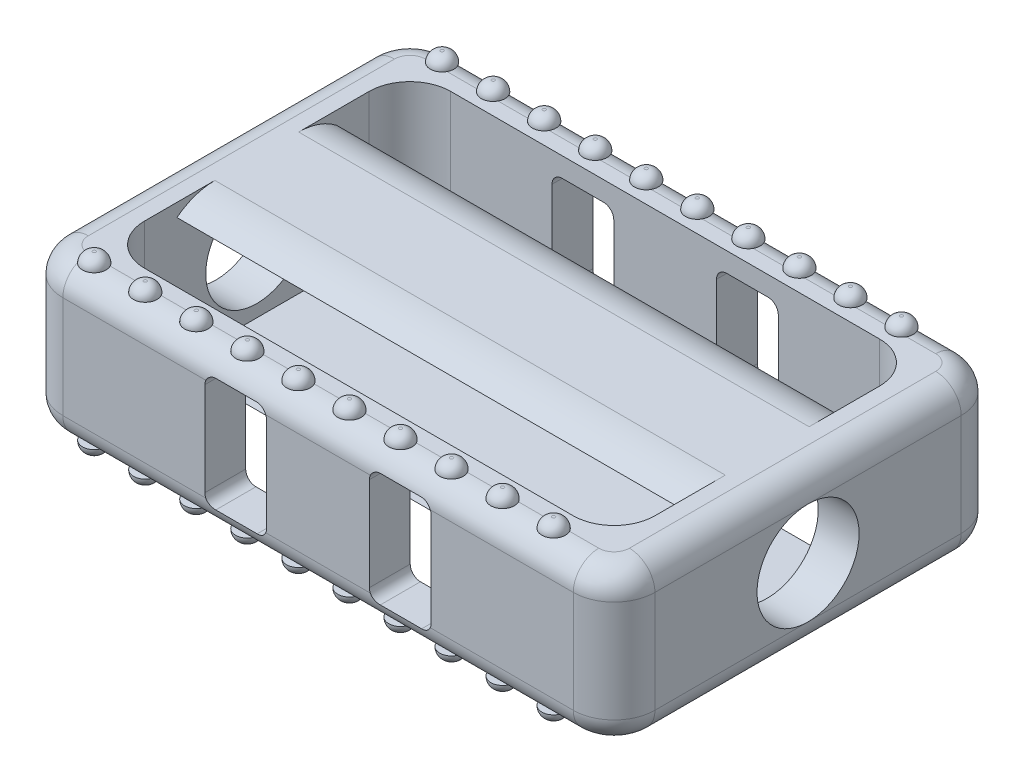
from build123d import *

# Parameters (mm, degrees)
BOSS_EXTRUDE3_DEPTH     = 15
CUT_EXTRUDE1_DEPTH      = 97.772930099
CUT_EXTRUDE2_DEPTH      = 116.468610453
CUT_EXTRUDE2_DEPTH_BACK = 116.468610453
SKETCH5_R               = 10
FILLET2_R               = 5
SKETCH7_R               = 2.307900458
BOSS_EXTRUDE5_DEPTH     = 2
FILLET3_R               = 2
LPATTERN2_COUNT         = 10
LPATTERN2_PITCH         = 10
FILLET3_OF_LPATTERN2_R  = 2
SKETCH8_W               = 31.286349066
SKETCH8_H               = 2.579791074
BOSS_EXTRUDE6_DEPTH     = 100
FILLET4_R               = 12


with BuildPart() as part:
    # Sketch3 → Boss-Extrude3 (new, symmetric)
    with BuildSketch(Plane(origin=(0, 0, 0), x_dir=(1, 0, 0), z_dir=(0, 1, 0))):
        with BuildLine():
            Line((-58, -30), (-58, 30))
            ThreePointArc((-58, 30), (-55.656854249, 35.656854249), (-50, 38))
            Line((-50, 38), (50, 38))
            ThreePointArc((50, 38), (55.656854249, 35.656854249), (58, 30))
            Line((58, 30), (58, -30))
            ThreePointArc((58, -30), (55.656854249, -35.656854249), (50, -38))
            Line((50, -38), (-50, -38))
            ThreePointArc((-50, -38), (-55.656854249, -35.656854249), (-58, -30))
        make_face()
        with BuildLine():
            Line((-50, -22), (-50, 22))
            ThreePointArc((-50, 22), (-47.656854249, 27.656854249), (-42, 30))
            Line((-42, 30), (42, 30))
            ThreePointArc((42, 30), (47.656854249, 27.656854249), (50, 22))
            Line((50, 22), (50, -22))
            ThreePointArc((50, -22), (47.656854249, -27.656854249), (42, -30))
            Line((42, -30), (-42, -30))
            ThreePointArc((-42, -30), (-47.656854249, -27.656854249), (-50, -22))
        make_face(mode=Mode.SUBTRACT)
    extrude(amount=BOSS_EXTRUDE3_DEPTH, both=True)

    # Sketch6 → Cut-Extrude1 (cut, through all)
    with BuildSketch(Plane(origin=(0, 0, -38), x_dir=(-1, 0, 0), z_dir=(0, 0, -1))):
        with BuildLine():
            Line((-12.061941408, -11.16246625), (-20.167714665, -11.16246625))
            ThreePointArc((-20.167714665, -11.16246625), (-21.581928228, -10.576679812), (-22.167714665, -9.16246625))
            Line((-22.167714665, -9.16246625), (-22.167714665, 9.16246625))
            ThreePointArc((-22.167714665, 9.16246625), (-21.581928228, 10.576679812), (-20.167714665, 11.16246625))
            Line((-20.167714665, 11.16246625), (-12.061941408, 11.16246625))
            ThreePointArc((-12.061941408, 11.16246625), (-10.647727846, 10.576679812), (-10.061941408, 9.16246625))
            Line((-10.061941408, 9.16246625), (-10.061941408, -9.16246625))
            ThreePointArc((-10.061941408, -9.16246625), (-10.647727846, -10.576679812), (-12.061941408, -11.16246625))
        make_face()
        with BuildLine():
            Line((12.061941408, 11.16246625), (20.167714665, 11.16246625))
            ThreePointArc((20.167714665, 11.16246625), (21.581928228, 10.576679812), (22.167714665, 9.16246625))
            Line((22.167714665, 9.16246625), (22.167714665, -9.16246625))
            ThreePointArc((22.167714665, -9.16246625), (21.581928228, -10.576679812), (20.167714665, -11.16246625))
            Line((20.167714665, -11.16246625), (12.061941408, -11.16246625))
            ThreePointArc((12.061941408, -11.16246625), (10.647727846, -10.576679812), (10.061941408, -9.16246625))
            Line((10.061941408, -9.16246625), (10.061941408, 9.16246625))
            ThreePointArc((10.061941408, 9.16246625), (10.647727846, 10.576679812), (12.061941408, 11.16246625))
        make_face()
    extrude(amount=-CUT_EXTRUDE1_DEPTH, mode=Mode.SUBTRACT)

    # Sketch5 → Cut-Extrude2 (cut, two sides: drawn at the far end of the back side and taken through both)
    with BuildSketch(Plane.ZY.offset(-50).offset(-CUT_EXTRUDE2_DEPTH_BACK)):
        Circle(SKETCH5_R)
    extrude(amount=CUT_EXTRUDE2_DEPTH + CUT_EXTRUDE2_DEPTH_BACK, mode=Mode.SUBTRACT)

    # Fillet2
    # the kernel refuses this fillet: 5 mm, written as the material it takes off along each edge
    with BuildSketch(Plane(origin=(50, 15, -30), x_dir=(0, 0, -1), z_dir=(-1, 0, 0))) as fillet2_piece_1:
        with BuildLine():
            CenterArc((8 - FILLET2_R, FILLET2_R), FILLET2_R, 270, 90)
            Line((8, FILLET2_R), (8, 0))
            Line((8, 0), (8 - FILLET2_R, 0))
        make_face()
    revolve(axis=Axis((50, 15, -30), (0, -1, 0)), revolution_arc=90, mode=Mode.SUBTRACT)
    with BuildSketch(Plane(origin=(58, 15, -30), x_dir=(-1, 0, 0), z_dir=(0, 0, 1)), Plane(origin=(-58, -15, 30), x_dir=(0, 1, 0), z_dir=(0, 0, -1))) as fillet2_piece_2:
        with BuildLine():
            CenterArc((FILLET2_R, FILLET2_R), FILLET2_R, 180, 90)
            Line((0, FILLET2_R), (0, 0))
            Line((0, 0), (FILLET2_R, 0))
        make_face()
    extrude(amount=60, mode=Mode.SUBTRACT)
    with BuildSketch(Plane(origin=(50, 15, 30), x_dir=(1, 0, 0), z_dir=(0, 0, -1))) as fillet2_piece_3:
        with BuildLine():
            CenterArc((8 - FILLET2_R, FILLET2_R), FILLET2_R, 270, 90)
            Line((8, FILLET2_R), (8, 0))
            Line((8, 0), (8 - FILLET2_R, 0))
        make_face()
    revolve(axis=Axis((50, 15, 30), (0, -1, 0)), revolution_arc=90, mode=Mode.SUBTRACT)
    with BuildSketch(Plane(origin=(50, 15, 38), x_dir=(0, 0, -1), z_dir=(-1, 0, 0)), Plane(origin=(-50, 15, -38), x_dir=(0, 0, 1), z_dir=(1, 0, 0))) as fillet2_piece_4:
        with BuildLine():
            CenterArc((FILLET2_R, FILLET2_R), FILLET2_R, 180, 90)
            Line((0, FILLET2_R), (0, 0))
            Line((0, 0), (FILLET2_R, 0))
        make_face()
    extrude(amount=100, mode=Mode.SUBTRACT)
    with BuildSketch(Plane(origin=(-50, 15, 30), x_dir=(0, 0, 1), z_dir=(1, 0, 0))) as fillet2_piece_5:
        with BuildLine():
            CenterArc((8 - FILLET2_R, FILLET2_R), FILLET2_R, 270, 90)
            Line((8 - FILLET2_R, 0), (8, 0))
            Line((8, 0), (8, FILLET2_R))
        make_face()
    revolve(axis=Axis((-50, 15, 30), (0, -1, 0)), revolution_arc=90, mode=Mode.SUBTRACT)
    with BuildSketch(Plane(origin=(-58, 15, 30), x_dir=(0, -1, 0), z_dir=(0, 0, -1)), Plane(origin=(58, -15, -30), x_dir=(-1, 0, 0), z_dir=(0, 0, 1))) as fillet2_piece_6:
        with BuildLine():
            CenterArc((FILLET2_R, -FILLET2_R), FILLET2_R, 90, 90)
            Line((0, -FILLET2_R), (0, 0))
            Line((0, 0), (FILLET2_R, 0))
        make_face()
    extrude(amount=60, mode=Mode.SUBTRACT)
    with BuildSketch(Plane(origin=(-50, 15, -30), x_dir=(-1, 0, 0), z_dir=(0, 0, 1))) as fillet2_piece_7:
        with BuildLine():
            CenterArc((8 - FILLET2_R, FILLET2_R), FILLET2_R, 270, 90)
            Line((8, FILLET2_R), (8, 0))
            Line((8, 0), (8 - FILLET2_R, 0))
        make_face()
    revolve(axis=Axis((-50, 15, -30), (0, -1, 0)), revolution_arc=90, mode=Mode.SUBTRACT)
    with BuildSketch(Plane(origin=(50, -15, -30), x_dir=(0, 0, -1), z_dir=(-1, 0, 0))) as fillet2_piece_8:
        with BuildLine():
            CenterArc((8 - FILLET2_R, -FILLET2_R), FILLET2_R, 0, 90)
            Line((8, -FILLET2_R), (8, 0))
            Line((8, 0), (8 - FILLET2_R, 0))
        make_face()
    revolve(axis=Axis((50, -15, -30), (0, -1, 0)), revolution_arc=90, mode=Mode.SUBTRACT)
    with BuildSketch(Plane(origin=(50, -15, 30), x_dir=(1, 0, 0), z_dir=(0, 0, -1))) as fillet2_piece_9:
        with BuildLine():
            CenterArc((8 - FILLET2_R, -FILLET2_R), FILLET2_R, 0, 90)
            Line((8, -FILLET2_R), (8, 0))
            Line((8, 0), (8 - FILLET2_R, 0))
        make_face()
    revolve(axis=Axis((50, -15, 30), (0, -1, 0)), revolution_arc=90, mode=Mode.SUBTRACT)
    with BuildSketch(Plane(origin=(50, -15, 38), x_dir=(0, 0, -1), z_dir=(-1, 0, 0)), Plane(origin=(-50, -15, -38), x_dir=(0, 0, 1), z_dir=(1, 0, 0))) as fillet2_piece_10:
        with BuildLine():
            CenterArc((FILLET2_R, -FILLET2_R), FILLET2_R, 90, 90)
            Line((0, -FILLET2_R), (0, 0))
            Line((0, 0), (FILLET2_R, 0))
        make_face()
    extrude(amount=100, mode=Mode.SUBTRACT)
    with BuildSketch(Plane(origin=(-50, -15, 30), x_dir=(0, 0, 1), z_dir=(1, 0, 0))) as fillet2_piece_11:
        with BuildLine():
            CenterArc((8 - FILLET2_R, -FILLET2_R), FILLET2_R, 0, 90)
            Line((8 - FILLET2_R, 0), (8, 0))
            Line((8, 0), (8, -FILLET2_R))
        make_face()
    revolve(axis=Axis((-50, -15, 30), (0, -1, 0)), revolution_arc=90, mode=Mode.SUBTRACT)
    with BuildSketch(Plane(origin=(-50, -15, -30), x_dir=(-1, 0, 0), z_dir=(0, 0, 1))) as fillet2_piece_12:
        with BuildLine():
            CenterArc((8 - FILLET2_R, -FILLET2_R), FILLET2_R, 0, 90)
            Line((8, -FILLET2_R), (8, 0))
            Line((8, 0), (8 - FILLET2_R, 0))
        make_face()
    revolve(axis=Axis((-50, -15, -30), (0, -1, 0)), revolution_arc=90, mode=Mode.SUBTRACT)

    # Sketch7 → Boss-Extrude5 (add)
    with BuildSketch(Plane.XZ.offset(15)):
        with Locations(Location((42.233675122, 34.074896973, 0), (0, 0, 207.758556519))):
            Circle(SKETCH7_R)
    boss_extrude5 = extrude(amount=BOSS_EXTRUDE5_DEPTH)

    # Fillet3
    fillet3_edges = [part.edges().sort_by_distance(p)[0] for p in [
        (44.275977994, -17, 35.149793946),
    ]]
    fillet(fillet3_edges, radius=FILLET3_R - 0.0001)  # a hair under: the kernel refuses the full size

    # LPattern2: Boss-Extrude5 ×10
    with Locations(*[(-i * LPATTERN2_PITCH, 0, 0) for i in range(1, LPATTERN2_COUNT)]):
        add(boss_extrude5)

    # Fillet3 of LPattern2
    fillet3_of_lpattern2_edges = [part.edges().sort_by_distance(p)[0] for p in [
        (34.275977994, -17, 35.149793946),
        (24.275977994, -17, 35.149793946),
        (14.275977994, -17, 35.149793946),
        (4.275977994, -17, 35.149793946),
        (-5.724022006, -17, 35.149793946),
        (-15.724022006, -17, 35.149793946),
        (-25.724022006, -17, 35.149793946),
        (-35.724022006, -17, 35.149793946),
        (-45.724022006, -17, 35.149793946),
    ]]
    fillet(fillet3_of_lpattern2_edges, radius=FILLET3_OF_LPATTERN2_R - 0.0001)  # a hair under: the kernel refuses the full size

    # Mirror1: read off the stored shape, not the designer's step
    # Mirror1 outline → Mirror1 (revolve)
    with BuildSketch(Plane(origin=(42.233675122, 0, -34.074896973), x_dir=(1, 0, 0), z_dir=(0, 0, 1))):
        with BuildLine():
            Line((0, -15), (0, -17))
            Line((0, -17), (0.307900458, -17))
            ThreePointArc((0.307900458, -17), (1.722114021, -16.414213563), (2.307900458, -15))
            Line((2.307900458, -15), (0, -15))
        make_face()
    revolve(axis=Axis((42.233675122, 0, -34.074896973), (0, 1, 0)))

    # Mirror1 2 outline → Mirror1 2 (revolve)
    with BuildSketch(Plane(origin=(32.233675122, 0, -34.074896973), x_dir=(1, 0, 0), z_dir=(0, 0, 1))):
        with BuildLine():
            Line((0, -15), (0, -17))
            Line((0, -17), (0.307900458, -17))
            ThreePointArc((0.307900458, -17), (1.722114021, -16.414213563), (2.307900458, -15))
            Line((2.307900458, -15), (0, -15))
        make_face()
    revolve(axis=Axis((32.233675122, 0, -34.074896973), (0, 1, 0)))

    # Mirror1 3 outline → Mirror1 3 (revolve)
    with BuildSketch(Plane(origin=(22.233675122, 0, -34.074896973), x_dir=(1, 0, 0), z_dir=(0, 0, 1))):
        with BuildLine():
            Line((0, -15), (0, -17))
            Line((0, -17), (0.307900458, -17))
            ThreePointArc((0.307900458, -17), (1.722114021, -16.414213563), (2.307900458, -15))
            Line((2.307900458, -15), (0, -15))
        make_face()
    revolve(axis=Axis((22.233675122, 0, -34.074896973), (0, 1, 0)))

    # Mirror1 4 outline → Mirror1 4 (revolve)
    with BuildSketch(Plane(origin=(12.233675122, 0, -34.074896973), x_dir=(1, 0, 0), z_dir=(0, 0, 1))):
        with BuildLine():
            Line((0, -15), (0, -17))
            Line((0, -17), (0.307900458, -17))
            ThreePointArc((0.307900458, -17), (1.722114021, -16.414213563), (2.307900458, -15))
            Line((2.307900458, -15), (0, -15))
        make_face()
    revolve(axis=Axis((12.233675122, 0, -34.074896973), (0, 1, 0)))

    # Mirror1 5 outline → Mirror1 5 (revolve)
    with BuildSketch(Plane(origin=(2.233675122, 0, -34.074896973), x_dir=(1, 0, 0), z_dir=(0, 0, 1))):
        with BuildLine():
            Line((0, -15), (0, -17))
            Line((0, -17), (0.307900458, -17))
            ThreePointArc((0.307900458, -17), (1.722114021, -16.414213563), (2.307900458, -15))
            Line((2.307900458, -15), (0, -15))
        make_face()
    revolve(axis=Axis((2.233675122, 0, -34.074896973), (0, 1, 0)))

    # Mirror1 6 outline → Mirror1 6 (revolve)
    with BuildSketch(Plane(origin=(-7.766324878, 0, -34.074896973), x_dir=(1, 0, 0), z_dir=(0, 0, 1))):
        with BuildLine():
            Line((0, -15), (0, -17))
            Line((0, -17), (0.307900458, -17))
            ThreePointArc((0.307900458, -17), (1.722114021, -16.414213563), (2.307900458, -15))
            Line((2.307900458, -15), (0, -15))
        make_face()
    revolve(axis=Axis((-7.766324878, 0, -34.074896973), (0, 1, 0)))

    # Mirror1 7 outline → Mirror1 7 (revolve)
    with BuildSketch(Plane(origin=(-17.766324878, 0, -34.074896973), x_dir=(1, 0, 0), z_dir=(0, 0, 1))):
        with BuildLine():
            Line((0, -15), (0, -17))
            Line((0, -17), (0.307900458, -17))
            ThreePointArc((0.307900458, -17), (1.722114021, -16.414213563), (2.307900458, -15))
            Line((2.307900458, -15), (0, -15))
        make_face()
    revolve(axis=Axis((-17.766324878, 0, -34.074896973), (0, 1, 0)))

    # Mirror1 8 outline → Mirror1 8 (revolve)
    with BuildSketch(Plane(origin=(-27.766324878, 0, -34.074896973), x_dir=(1, 0, 0), z_dir=(0, 0, 1))):
        with BuildLine():
            Line((0, -15), (0, -17))
            Line((0, -17), (0.307900458, -17))
            ThreePointArc((0.307900458, -17), (1.722114021, -16.414213563), (2.307900458, -15))
            Line((2.307900458, -15), (0, -15))
        make_face()
    revolve(axis=Axis((-27.766324878, 0, -34.074896973), (0, 1, 0)))

    # Mirror1 9 outline → Mirror1 9 (revolve)
    with BuildSketch(Plane(origin=(-37.766324878, 0, -34.074896973), x_dir=(1, 0, 0), z_dir=(0, 0, 1))):
        with BuildLine():
            Line((0, -15), (0, -17))
            Line((0, -17), (0.307900458, -17))
            ThreePointArc((0.307900458, -17), (1.722114021, -16.414213563), (2.307900458, -15))
            Line((2.307900458, -15), (0, -15))
        make_face()
    revolve(axis=Axis((-37.766324878, 0, -34.074896973), (0, 1, 0)))

    # Mirror1 10 outline → Mirror1 10 (revolve)
    with BuildSketch(Plane(origin=(-47.766324878, 0, -34.074896973), x_dir=(1, 0, 0), z_dir=(0, 0, 1))):
        with BuildLine():
            Line((0, -15), (0, -17))
            Line((0, -17), (0.307900458, -17))
            ThreePointArc((0.307900458, -17), (1.722114021, -16.414213563), (2.307900458, -15))
            Line((2.307900458, -15), (0, -15))
        make_face()
    revolve(axis=Axis((-47.766324878, 0, -34.074896973), (0, 1, 0)))

    # Mirror2: read off the stored shape, not the designer's step
    # Mirror2 outline → Mirror2 (revolve)
    with BuildSketch(Plane(origin=(42.233675122, 0, -34.074896973), x_dir=(1, 0, 0), z_dir=(0, 0, 1))):
        with BuildLine():
            Line((0.307900458, 17), (0, 17))
            Line((0, 17), (0, 15))
            Line((0, 15), (2.307900458, 15))
            ThreePointArc((2.307900458, 15), (1.722114021, 16.414213563), (0.307900458, 17))
        make_face()
    revolve(axis=Axis((42.233675122, 0, -34.074896973), (0, 1, 0)))

    # Mirror2 2 outline → Mirror2 2 (revolve)
    with BuildSketch(Plane(origin=(32.233675122, 0, -34.074896973), x_dir=(1, 0, 0), z_dir=(0, 0, 1))):
        with BuildLine():
            Line((0.307900458, 17), (0, 17))
            Line((0, 17), (0, 15))
            Line((0, 15), (2.307900458, 15))
            ThreePointArc((2.307900458, 15), (1.722114021, 16.414213563), (0.307900458, 17))
        make_face()
    revolve(axis=Axis((32.233675122, 0, -34.074896973), (0, 1, 0)))

    # Mirror2 3 outline → Mirror2 3 (revolve)
    with BuildSketch(Plane(origin=(22.233675122, 0, -34.074896973), x_dir=(1, 0, 0), z_dir=(0, 0, 1))):
        with BuildLine():
            Line((0.307900458, 17), (0, 17))
            Line((0, 17), (0, 15))
            Line((0, 15), (2.307900458, 15))
            ThreePointArc((2.307900458, 15), (1.722114021, 16.414213563), (0.307900458, 17))
        make_face()
    revolve(axis=Axis((22.233675122, 0, -34.074896973), (0, 1, 0)))

    # Mirror2 4 outline → Mirror2 4 (revolve)
    with BuildSketch(Plane(origin=(12.233675122, 0, -34.074896973), x_dir=(1, 0, 0), z_dir=(0, 0, 1))):
        with BuildLine():
            Line((0.307900458, 17), (0, 17))
            Line((0, 17), (0, 15))
            Line((0, 15), (2.307900458, 15))
            ThreePointArc((2.307900458, 15), (1.722114021, 16.414213563), (0.307900458, 17))
        make_face()
    revolve(axis=Axis((12.233675122, 0, -34.074896973), (0, 1, 0)))

    # Mirror2 5 outline → Mirror2 5 (revolve)
    with BuildSketch(Plane(origin=(2.233675122, 0, -34.074896973), x_dir=(1, 0, 0), z_dir=(0, 0, 1))):
        with BuildLine():
            Line((0.307900458, 17), (0, 17))
            Line((0, 17), (0, 15))
            Line((0, 15), (2.307900458, 15))
            ThreePointArc((2.307900458, 15), (1.722114021, 16.414213563), (0.307900458, 17))
        make_face()
    revolve(axis=Axis((2.233675122, 0, -34.074896973), (0, 1, 0)))

    # Mirror2 6 outline → Mirror2 6 (revolve)
    with BuildSketch(Plane(origin=(-7.766324878, 0, -34.074896973), x_dir=(1, 0, 0), z_dir=(0, 0, 1))):
        with BuildLine():
            Line((0.307900458, 17), (0, 17))
            Line((0, 17), (0, 15))
            Line((0, 15), (2.307900458, 15))
            ThreePointArc((2.307900458, 15), (1.722114021, 16.414213563), (0.307900458, 17))
        make_face()
    revolve(axis=Axis((-7.766324878, 0, -34.074896973), (0, 1, 0)))

    # Mirror2 7 outline → Mirror2 7 (revolve)
    with BuildSketch(Plane(origin=(-17.766324878, 0, -34.074896973), x_dir=(1, 0, 0), z_dir=(0, 0, 1))):
        with BuildLine():
            Line((0.307900458, 17), (0, 17))
            Line((0, 17), (0, 15))
            Line((0, 15), (2.307900458, 15))
            ThreePointArc((2.307900458, 15), (1.722114021, 16.414213563), (0.307900458, 17))
        make_face()
    revolve(axis=Axis((-17.766324878, 0, -34.074896973), (0, 1, 0)))

    # Mirror2 8 outline → Mirror2 8 (revolve)
    with BuildSketch(Plane(origin=(-27.766324878, 0, -34.074896973), x_dir=(1, 0, 0), z_dir=(0, 0, 1))):
        with BuildLine():
            Line((0.307900458, 17), (0, 17))
            Line((0, 17), (0, 15))
            Line((0, 15), (2.307900458, 15))
            ThreePointArc((2.307900458, 15), (1.722114021, 16.414213563), (0.307900458, 17))
        make_face()
    revolve(axis=Axis((-27.766324878, 0, -34.074896973), (0, 1, 0)))

    # Mirror2 9 outline → Mirror2 9 (revolve)
    with BuildSketch(Plane(origin=(-37.766324878, 0, -34.074896973), x_dir=(1, 0, 0), z_dir=(0, 0, 1))):
        with BuildLine():
            Line((0.307900458, 17), (0, 17))
            Line((0, 17), (0, 15))
            Line((0, 15), (2.307900458, 15))
            ThreePointArc((2.307900458, 15), (1.722114021, 16.414213563), (0.307900458, 17))
        make_face()
    revolve(axis=Axis((-37.766324878, 0, -34.074896973), (0, 1, 0)))

    # Mirror2 10 outline → Mirror2 10 (revolve)
    with BuildSketch(Plane(origin=(-47.766324878, 0, -34.074896973), x_dir=(1, 0, 0), z_dir=(0, 0, 1))):
        with BuildLine():
            Line((0.307900458, 17), (0, 17))
            Line((0, 17), (0, 15))
            Line((0, 15), (2.307900458, 15))
            ThreePointArc((2.307900458, 15), (1.722114021, 16.414213563), (0.307900458, 17))
        make_face()
    revolve(axis=Axis((-47.766324878, 0, -34.074896973), (0, 1, 0)))

    # Mirror2 11 outline → Mirror2 11 (revolve)
    with BuildSketch(Plane(origin=(42.233675122, 0, 34.074896973), x_dir=(1, 0, 0), z_dir=(0, 0, 1))):
        with BuildLine():
            Line((0.307900458, 17), (0, 17))
            Line((0, 17), (0, 15))
            Line((0, 15), (2.307900458, 15))
            ThreePointArc((2.307900458, 15), (1.722114021, 16.414213563), (0.307900458, 17))
        make_face()
    revolve(axis=Axis((42.233675122, 0, 34.074896973), (0, 1, 0)))

    # Mirror2 12 outline → Mirror2 12 (revolve)
    with BuildSketch(Plane(origin=(32.233675122, 0, 34.074896973), x_dir=(1, 0, 0), z_dir=(0, 0, 1))):
        with BuildLine():
            Line((0.307900458, 17), (0, 17))
            Line((0, 17), (0, 15))
            Line((0, 15), (2.307900458, 15))
            ThreePointArc((2.307900458, 15), (1.722114021, 16.414213563), (0.307900458, 17))
        make_face()
    revolve(axis=Axis((32.233675122, 0, 34.074896973), (0, 1, 0)))

    # Mirror2 13 outline → Mirror2 13 (revolve)
    with BuildSketch(Plane(origin=(22.233675122, 0, 34.074896973), x_dir=(1, 0, 0), z_dir=(0, 0, 1))):
        with BuildLine():
            Line((0.307900458, 17), (0, 17))
            Line((0, 17), (0, 15))
            Line((0, 15), (2.307900458, 15))
            ThreePointArc((2.307900458, 15), (1.722114021, 16.414213563), (0.307900458, 17))
        make_face()
    revolve(axis=Axis((22.233675122, 0, 34.074896973), (0, 1, 0)))

    # Mirror2 14 outline → Mirror2 14 (revolve)
    with BuildSketch(Plane(origin=(12.233675122, 0, 34.074896973), x_dir=(1, 0, 0), z_dir=(0, 0, 1))):
        with BuildLine():
            Line((0.307900458, 17), (0, 17))
            Line((0, 17), (0, 15))
            Line((0, 15), (2.307900458, 15))
            ThreePointArc((2.307900458, 15), (1.722114021, 16.414213563), (0.307900458, 17))
        make_face()
    revolve(axis=Axis((12.233675122, 0, 34.074896973), (0, 1, 0)))

    # Mirror2 15 outline → Mirror2 15 (revolve)
    with BuildSketch(Plane(origin=(2.233675122, 0, 34.074896973), x_dir=(1, 0, 0), z_dir=(0, 0, 1))):
        with BuildLine():
            Line((0.307900458, 17), (0, 17))
            Line((0, 17), (0, 15))
            Line((0, 15), (2.307900458, 15))
            ThreePointArc((2.307900458, 15), (1.722114021, 16.414213563), (0.307900458, 17))
        make_face()
    revolve(axis=Axis((2.233675122, 0, 34.074896973), (0, 1, 0)))

    # Mirror2 16 outline → Mirror2 16 (revolve)
    with BuildSketch(Plane(origin=(-7.766324878, 0, 34.074896973), x_dir=(1, 0, 0), z_dir=(0, 0, 1))):
        with BuildLine():
            Line((0.307900458, 17), (0, 17))
            Line((0, 17), (0, 15))
            Line((0, 15), (2.307900458, 15))
            ThreePointArc((2.307900458, 15), (1.722114021, 16.414213563), (0.307900458, 17))
        make_face()
    revolve(axis=Axis((-7.766324878, 0, 34.074896973), (0, 1, 0)))

    # Mirror2 17 outline → Mirror2 17 (revolve)
    with BuildSketch(Plane(origin=(-17.766324878, 0, 34.074896973), x_dir=(1, 0, 0), z_dir=(0, 0, 1))):
        with BuildLine():
            Line((0.307900458, 17), (0, 17))
            Line((0, 17), (0, 15))
            Line((0, 15), (2.307900458, 15))
            ThreePointArc((2.307900458, 15), (1.722114021, 16.414213563), (0.307900458, 17))
        make_face()
    revolve(axis=Axis((-17.766324878, 0, 34.074896973), (0, 1, 0)))

    # Mirror2 18 outline → Mirror2 18 (revolve)
    with BuildSketch(Plane(origin=(-27.766324878, 0, 34.074896973), x_dir=(1, 0, 0), z_dir=(0, 0, 1))):
        with BuildLine():
            Line((0.307900458, 17), (0, 17))
            Line((0, 17), (0, 15))
            Line((0, 15), (2.307900458, 15))
            ThreePointArc((2.307900458, 15), (1.722114021, 16.414213563), (0.307900458, 17))
        make_face()
    revolve(axis=Axis((-27.766324878, 0, 34.074896973), (0, 1, 0)))

    # Mirror2 19 outline → Mirror2 19 (revolve)
    with BuildSketch(Plane(origin=(-37.766324878, 0, 34.074896973), x_dir=(1, 0, 0), z_dir=(0, 0, 1))):
        with BuildLine():
            Line((0.307900458, 17), (0, 17))
            Line((0, 17), (0, 15))
            Line((0, 15), (2.307900458, 15))
            ThreePointArc((2.307900458, 15), (1.722114021, 16.414213563), (0.307900458, 17))
        make_face()
    revolve(axis=Axis((-37.766324878, 0, 34.074896973), (0, 1, 0)))

    # Mirror2 20 outline → Mirror2 20 (revolve)
    with BuildSketch(Plane(origin=(-47.766324878, 0, 34.074896973), x_dir=(1, 0, 0), z_dir=(0, 0, 1))):
        with BuildLine():
            Line((0.307900458, 17), (0, 17))
            Line((0, 17), (0, 15))
            Line((0, 15), (2.307900458, 15))
            ThreePointArc((2.307900458, 15), (1.722114021, 16.414213563), (0.307900458, 17))
        make_face()
    revolve(axis=Axis((-47.766324878, 0, 34.074896973), (0, 1, 0)))

    # Sketch8 → Boss-Extrude6 (add)
    with BuildSketch(Plane(origin=(-50, 0, 0), x_dir=(0, 0, -1), z_dir=(1, 0, 0))):
        with Locations((0, 13.710104463)):
            Rectangle(SKETCH8_W, SKETCH8_H)
    boss_extrude6 = extrude(amount=BOSS_EXTRUDE6_DEPTH)

    # Mirror3: Boss-Extrude6 across plane
    add(boss_extrude6.mirror(Plane.ZX))

    # Fillet4
    # the kernel refuses this fillet: 12 mm, written as the material it takes off along each edge
    with BuildSketch(Plane(origin=(-50, -15, 15.643174533), x_dir=(0, 0, -1), z_dir=(1, 0, 0)), Plane(origin=(-50, 15, -15.643174533), x_dir=(0, 0, 1), z_dir=(1, 0, 0))) as fillet4_piece_1:
        with BuildLine():
            CenterArc((7.433684402, 12), FILLET4_R, 231.722288548, 38.277711452)
            Line((0, 2.579791074), (0, 0))
            Line((0, 0), (7.433684402, 0))
        make_face()
    extrude(amount=100, mode=Mode.SUBTRACT)
    with BuildSketch(Plane(origin=(-50, -15, -15.643174533), x_dir=(0, 0, 1), z_dir=(1, 0, 0)), Plane(origin=(-50, 15, 15.643174533), x_dir=(0, 0, -1), z_dir=(1, 0, 0))) as fillet4_piece_2:
        with BuildLine():
            CenterArc((7.433684402, -12), FILLET4_R, 90, 38.277711452)
            Line((0, -2.579791074), (0, 0))
            Line((0, 0), (7.433684402, 0))
        make_face()
    extrude(amount=100, mode=Mode.SUBTRACT)


solid = part.part
